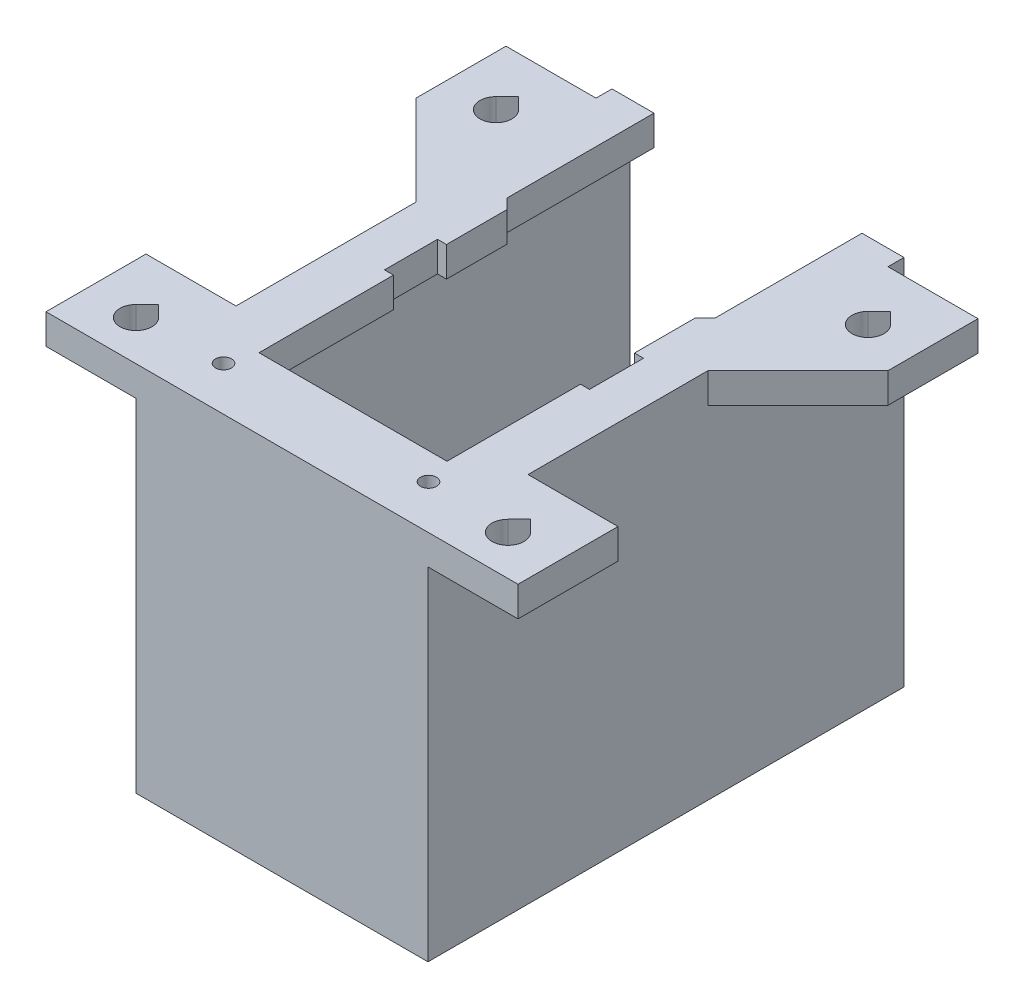
from build123d import *

# Parameters (mm, degrees)
SKETCH1_R               = 0.8
BOSS_EXTRUDE2_DEPTH     = 2
BOSS_EXTRUDE4_DEPTH     = 35.2
BOSS_EXTRUDE7_OUTLINE_R = 0.8
BOSS_EXTRUDE7_DEPTH     = 37.2
SKETCH1_10_R            = 0.8
CUT_EXTRUDE6_DEPTH      = 34.2
SKETCH1_11_R            = 0.8
BOSS_EXTRUDE8_DEPTH     = 2
SKETCH2_W               = 9
SKETCH2_H               = 8
SKETCH2_H_2             = 10
BOSS_EXTRUDE9_DEPTH     = 3
CHAMFER1_SIZE           = 10


# Read off the part's stored shape, not the designer's step: Boss-Extrude7
with BuildPart() as part:
    # Sketch1 → Boss-Extrude2 (new body)
    with BuildSketch(Plane(origin=(0, 0, 0), x_dir=(1, 0, 0), z_dir=(0, 1, 0))):
        Polygon((-10.4, 16.242178951), (-10.4, 30.95), (-14.6, 30.95), (-14.6, -16.65), (14.6, -16.65), (14.6, 30.95), (10.4, 30.95), (10.4, 16.242178951), (7.2, 13.042178951), (7.2, -14.85), (-7.2, -14.85), (-7.2, 13.042178951), align=None)
        with Locations(Location((-10.25, -8.45, 0), (0, 0, 270))):
            Circle(SKETCH1_R, mode=Mode.SUBTRACT)
        with Locations(Location((-10.25, 12.25, 0), (0, 0, 270))):
            Circle(SKETCH1_R, mode=Mode.SUBTRACT)
        with Locations(Location((-10.25, -12.25, 0), (0, 0, 270))):
            Circle(SKETCH1_R, mode=Mode.SUBTRACT)
        with Locations(Location((10.25, -8.45, 0), (0, 0, 270))):
            Circle(SKETCH1_R, mode=Mode.SUBTRACT)
        with Locations(Location((10.25, -12.25, 0), (0, 0, 270))):
            Circle(SKETCH1_R, mode=Mode.SUBTRACT)
        with Locations(Location((10.25, 12.25, 0), (0, 0, 270))):
            Circle(SKETCH1_R, mode=Mode.SUBTRACT)
    extrude(amount=BOSS_EXTRUDE2_DEPTH)

    # Sketch1<6> → Boss-Extrude4 (add)
    with BuildSketch(Plane(origin=(0, 0, 0), x_dir=(1, 0, 0), z_dir=(0, 1, 0))):
        Polygon((-12.8, -14.85), (-12.8, 30.95), (-14.6, 30.95), (-14.6, -16.65), (14.6, -16.65), (14.6, 30.95), (12.8, 30.95), (12.8, -14.85), align=None)
    extrude(amount=BOSS_EXTRUDE4_DEPTH)

    # Boss-Extrude7 outline → Boss-Extrude7 (add)
    with BuildSketch(Plane(origin=(0, 0, 0), x_dir=(1, 0, 0), z_dir=(0, 1, 0))):
        Polygon((14.6, -16.65), (14.6, 30.95), (10.4, 30.95), (10.4, 16.242178951), (9.4, 15.242178951), (9.4, 9.2), (10.3, 9.2), (10.3, 3.8), (9.4, 3.8), (9.4, -9.55), (-9.4, -9.55), (-9.4, 3.9), (-10.3, 3.9), (-10.3, 9.2), (-9.4, 9.2), (-9.4, 15.242178951), (-10.4, 16.242178951), (-10.4, 30.95), (-14.6, 30.95), (-14.6, -16.65), align=None)
        with Locations((-10.25, -12.25)):
            Circle(BOSS_EXTRUDE7_OUTLINE_R, mode=Mode.SUBTRACT)
        with Locations((10.25, -12.25)):
            Circle(BOSS_EXTRUDE7_OUTLINE_R, mode=Mode.SUBTRACT)
    extrude(amount=BOSS_EXTRUDE7_DEPTH)

    # Sketch1<10> → Cut-Extrude6 (cut)
    with BuildSketch(Plane(origin=(0, 0, 0), x_dir=(1, 0, 0), z_dir=(0, 1, 0))):
        Polygon((-10.4, 16.242178951), (-10.4, 30.95), (-12.8, 30.95), (-12.8, -14.85), (12.8, -14.85), (12.8, 30.95), (10.4, 30.95), (10.4, 16.242178951), (7.2, 13.042178951), (7.2, -9.55), (-7.2, -9.55), (-7.2, 13.042178951), align=None)
        with Locations(Location((-10.25, -12.25, 0), (0, 0, 270))):
            Circle(SKETCH1_10_R, mode=Mode.SUBTRACT)
        with Locations(Location((10.25, -12.25, 0), (0, 0, 270))):
            Circle(SKETCH1_10_R, mode=Mode.SUBTRACT)
    extrude(amount=CUT_EXTRUDE6_DEPTH, mode=Mode.SUBTRACT)

    # Sketch1<11> → Boss-Extrude8 (add)
    # profile 1 of 2: a face of its own
    with BuildSketch(Plane(origin=(0, 0, 0), x_dir=(1, 0, 0), z_dir=(0, 1, 0))):
        Polygon((-10.4, 16.242178951), (-10.4, 30.95), (-12.8, 30.95), (-12.8, -14.85), (-7.2, -14.85), (-7.2, 13.042178951), align=None)
        with Locations(Location((-10.25, -8.45, 0), (0, 0, 270))):
            Circle(SKETCH1_11_R, mode=Mode.SUBTRACT)
        with Locations(Location((-10.25, 12.25, 0), (0, 0, 270))):
            Circle(SKETCH1_11_R, mode=Mode.SUBTRACT)
    # profile 2 of 2: a face of its own
    with BuildSketch(Plane(origin=(0, 0, 0), x_dir=(1, 0, 0), z_dir=(0, 1, 0))):
        Polygon((7.2, -14.85), (12.8, -14.85), (12.8, 30.95), (10.4, 30.95), (10.4, 16.242178951), (7.2, 13.042178951), align=None)
        with Locations(Location((10.25, -8.45, 0), (0, 0, 270))):
            Circle(SKETCH1_11_R, mode=Mode.SUBTRACT)
        with Locations(Location((10.25, 12.25, 0), (0, 0, 270))):
            Circle(SKETCH1_11_R, mode=Mode.SUBTRACT)
    extrude(amount=BOSS_EXTRUDE8_DEPTH)

    # Sketch2 → Boss-Extrude9 (add)
    # profile 1 of 4: a face of its own
    with BuildSketch(Plane(origin=(0, 37.2, 0), x_dir=(1, 0, 0), z_dir=(0, 1, 0))):
        with Locations((-19.1, 25.35)):
            Rectangle(SKETCH2_W, SKETCH2_H)
        with BuildLine():
            ThreePointArc((-17.46862915, 24.48137085), (-18.6, 21.75), (-19.73137085, 24.48137085))
            Line((-19.73137085, 24.48137085), (-18.6, 25.6127417))
            Line((-18.6, 25.6127417), (-17.46862915, 24.48137085))
        make_face(mode=Mode.SUBTRACT)
    # profile 2 of 4: a face of its own
    with BuildSketch(Plane(origin=(0, 37.2, 0), x_dir=(1, 0, 0), z_dir=(0, 1, 0))):
        with Locations((19.1, 25.35)):
            Rectangle(SKETCH2_W, SKETCH2_H)
        with BuildLine():
            Line((18.6, 25.6127417), (19.73137085, 24.48137085))
            ThreePointArc((19.73137085, 24.48137085), (18.6, 21.75), (17.46862915, 24.48137085))
            Line((17.46862915, 24.48137085), (18.6, 25.6127417))
        make_face(mode=Mode.SUBTRACT)
    # profile 3 of 4: a face of its own
    with BuildSketch(Plane(origin=(0, 37.2, 0), x_dir=(1, 0, 0), z_dir=(0, 1, 0))):
        with Locations((-19.1, -11.65)):
            Rectangle(SKETCH2_W, SKETCH2_H_2)
        with BuildLine():
            Line((-19.73137085, -11.51862915), (-18.6, -10.3872583))
            Line((-18.6, -10.3872583), (-17.46862915, -11.51862915))
            ThreePointArc((-17.46862915, -11.51862915), (-18.6, -14.25), (-19.73137085, -11.51862915))
        make_face(mode=Mode.SUBTRACT)
    # profile 4 of 4: a face of its own
    with BuildSketch(Plane(origin=(0, 37.2, 0), x_dir=(1, 0, 0), z_dir=(0, 1, 0))):
        with Locations((19.1, -11.65)):
            Rectangle(SKETCH2_W, SKETCH2_H_2)
        with BuildLine():
            Line((17.46862915, -11.51862915), (18.6, -10.3872583))
            Line((18.6, -10.3872583), (19.73137085, -11.51862915))
            ThreePointArc((19.73137085, -11.51862915), (18.6, -14.25), (17.46862915, -11.51862915))
        make_face(mode=Mode.SUBTRACT)
    extrude(amount=-BOSS_EXTRUDE9_DEPTH)

    # Chamfer1
    # the kernel refuses this chamfer: 10 mm, written as the material it adds along each edge
    with BuildSketch(Plane(origin=(14.6, 37.2, -21.35), x_dir=(0.9996219169112968, 0, -0.027495876610586667), z_dir=(0, -1, 0))) as chamfer1_piece_1_section:
        Polygon((CHAMFER1_SIZE * 0.999621916911, CHAMFER1_SIZE * 0.0274958766106), (-CHAMFER1_SIZE * 0.0274958766106, CHAMFER1_SIZE * 0.999621916911), (0, 0), align=None)
    chamfer1_piece_1 = extrude(amount=3, mode=Mode.PRIVATE)
    chamfer1_piece_1 = split(chamfer1_piece_1, bisect_by=Plane(origin=(23.6, 35.7, -17.990992529), z_dir=(-1, 0, 0)), keep=Keep.TOP, mode=Mode.PRIVATE)
    add(chamfer1_piece_1)
    with BuildSketch(Plane(origin=(-14.6, 37.2, -21.35), x_dir=(-0.9996219169112968, 0, -0.027495876610586324), z_dir=(0, -1, 0))) as chamfer1_piece_2_section:
        Polygon((CHAMFER1_SIZE * 0.999621916911, -CHAMFER1_SIZE * 0.0274958766106), (-CHAMFER1_SIZE * 0.0274958766106, -CHAMFER1_SIZE * 0.999621916911), (0, 0), align=None)
    chamfer1_piece_2 = extrude(amount=3, mode=Mode.PRIVATE)
    chamfer1_piece_2 = split(chamfer1_piece_2, bisect_by=Plane(origin=(-23.6, 35.7, -17.990992529), z_dir=(1, 0, 0)), keep=Keep.TOP, mode=Mode.PRIVATE)
    add(chamfer1_piece_2)


solid = part.part
